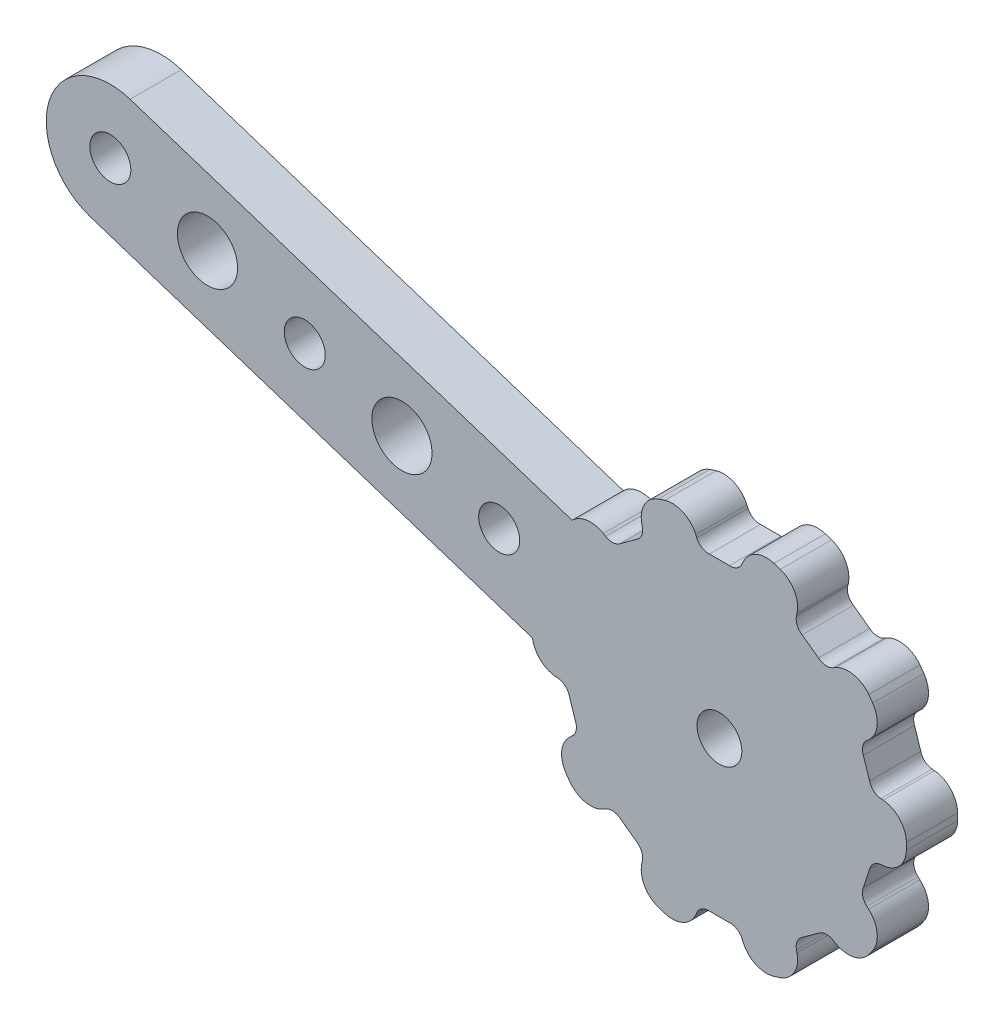
from build123d import *

# Parameters (mm, degrees)
SKETCH1_R           = 1.75
BOSS_EXTRUDE1_DEPTH = 4
BOSS_EXTRUDE2_START = -4
SKETCH2_R           = 1.6
SKETCH2_R_2         = 2.35
BOSS_EXTRUDE2_DEPTH = 4
FILLET1_R           = 2


with BuildPart() as part:
    # Sketch1 → Boss-Extrude1 (new body)
    with BuildSketch(Plane.XY):
        with BuildLine():
            Line((6.458174517, 10.22648556), (7.730280052, 9.302246788))
            ThreePointArc((7.730280052, 9.302246788), (8.293531937, 9.074228241), (8.884801529, 9.214390334))
            ThreePointArc((8.884801529, 9.214390334), (9.700788202, 9.679292345), (10.537793023, 10.105192636))
            ThreePointArc((10.537793023, 10.105192636), (11.811648118, 8.581664683), (12.866966432, 6.899360466))
            ThreePointArc((12.866966432, 6.899360466), (12.203262471, 6.234932004), (11.508960635, 5.602545185))
            ThreePointArc((11.508960635, 5.602545185), (11.192946211, 5.083526854), (11.235750332, 4.477380873))
            Line((11.235750332, 4.477380873), (11.721651409, 2.981931127))
            ThreePointArc((11.721651409, 2.981931127), (12.043305816, 2.466389096), (12.604038176, 2.232243064))
            ThreePointArc((12.604038176, 2.232243064), (13.537447807, 2.12873176), (14.464936842, 1.981313243))
            ThreePointArc((14.464936842, 1.981313243), (14.6, 0), (14.464936842, -1.981313243))
            ThreePointArc((14.464936842, -1.981313243), (13.537447807, -2.12873176), (12.604038176, -2.232243064))
            ThreePointArc((12.604038176, -2.232243064), (12.043305816, -2.466389096), (11.721651409, -2.981931127))
            Line((11.721651409, -2.981931127), (11.235750332, -4.477380873))
            ThreePointArc((11.235750332, -4.477380873), (11.192946211, -5.083526854), (11.508960635, -5.602545185))
            ThreePointArc((11.508960635, -5.602545185), (12.203262471, -6.234932004), (12.866966432, -6.899360466))
            ThreePointArc((12.866966432, -6.899360466), (11.811648118, -8.581664683), (10.537793023, -10.105192636))
            ThreePointArc((10.537793023, -10.105192636), (9.700788202, -9.679292345), (8.884801529, -9.214390334))
            ThreePointArc((8.884801529, -9.214390334), (8.293531937, -9.074228241), (7.730280052, -9.302246788))
            Line((7.730280052, -9.302246788), (6.458174517, -10.22648556))
            ThreePointArc((6.458174517, -10.22648556), (6.067261587, -10.691708329), (6.017851306, -11.297351596))
            ThreePointArc((6.017851306, -11.297351596), (6.207845644, -12.21706366), (6.354252177, -13.144712978))
            ThreePointArc((6.354252177, -13.144712978), (4.511648118, -13.885425138), (2.585570436, -14.369231904))
            ThreePointArc((2.585570436, -14.369231904), (2.158757221, -13.532692241), (1.771872682, -12.676953681))
            ThreePointArc((1.771872682, -12.676953681), (1.375910744, -12.216020619), (0.786204458, -12.069420349))
            Line((0.786204458, -12.069420349), (-0.786204458, -12.069420349))
            ThreePointArc((-0.786204458, -12.069420349), (-1.375910744, -12.216020619), (-1.771872682, -12.676953681))
            ThreePointArc((-1.771872682, -12.676953681), (-2.158757221, -13.532692241), (-2.585570436, -14.369231904))
            ThreePointArc((-2.585570436, -14.369231904), (-4.511648118, -13.885425138), (-6.354252177, -13.144712978))
            ThreePointArc((-6.354252177, -13.144712978), (-6.207845644, -12.21706366), (-6.017851306, -11.297351596))
            ThreePointArc((-6.017851306, -11.297351596), (-6.067261587, -10.691708329), (-6.458174517, -10.22648556))
            Line((-6.458174517, -10.22648556), (-7.730280052, -9.302246788))
            ThreePointArc((-7.730280052, -9.302246788), (-8.293531937, -9.074228241), (-8.884801529, -9.214390334))
            ThreePointArc((-8.884801529, -9.214390334), (-9.700788202, -9.679292345), (-10.537793023, -10.105192636))
            ThreePointArc((-10.537793023, -10.105192636), (-11.811648118, -8.581664683), (-12.866966432, -6.899360466))
            ThreePointArc((-12.866966432, -6.899360466), (-12.203262471, -6.234932004), (-11.508960635, -5.602545185))
            ThreePointArc((-11.508960635, -5.602545185), (-11.192946211, -5.083526854), (-11.235750332, -4.477380873))
            Line((-11.235750332, -4.477380873), (-11.721651409, -2.981931127))
            ThreePointArc((-11.721651409, -2.981931127), (-12.043305816, -2.466389096), (-12.604038176, -2.232243064))
            ThreePointArc((-12.604038176, -2.232243064), (-13.537447807, -2.12873176), (-14.464936842, -1.981313243))
            ThreePointArc((-14.464936842, -1.981313243), (-14.6, 0), (-14.464936842, 1.981313243))
            ThreePointArc((-14.464936842, 1.981313243), (-13.537447807, 2.12873176), (-12.604038176, 2.232243064))
            ThreePointArc((-12.604038176, 2.232243064), (-12.043305816, 2.466389096), (-11.721651409, 2.981931127))
            Line((-11.721651409, 2.981931127), (-11.235750332, 4.477380873))
            ThreePointArc((-11.235750332, 4.477380873), (-11.192946211, 5.083526854), (-11.508960635, 5.602545185))
            ThreePointArc((-11.508960635, 5.602545185), (-12.203262471, 6.234932004), (-12.866966432, 6.899360466))
            ThreePointArc((-12.866966432, 6.899360466), (-11.811648118, 8.581664683), (-10.537793023, 10.105192636))
            ThreePointArc((-10.537793023, 10.105192636), (-9.700788202, 9.679292345), (-8.884801529, 9.214390334))
            ThreePointArc((-8.884801529, 9.214390334), (-8.293531937, 9.074228241), (-7.730280052, 9.302246788))
            Line((-7.730280052, 9.302246788), (-6.458174517, 10.22648556))
            ThreePointArc((-6.458174517, 10.22648556), (-6.067261587, 10.691708329), (-6.017851306, 11.297351596))
            ThreePointArc((-6.017851306, 11.297351596), (-6.207845644, 12.21706366), (-6.354252177, 13.144712978))
            ThreePointArc((-6.354252177, 13.144712978), (-4.511648118, 13.885425138), (-2.585570436, 14.369231904))
            ThreePointArc((-2.585570436, 14.369231904), (-2.158757221, 13.532692241), (-1.771872682, 12.676953681))
            ThreePointArc((-1.771872682, 12.676953681), (-1.375910744, 12.216020619), (-0.786204458, 12.069420349))
            Line((-0.786204458, 12.069420349), (0.786204458, 12.069420349))
            ThreePointArc((0.786204458, 12.069420349), (1.375910744, 12.216020619), (1.771872682, 12.676953681))
            ThreePointArc((1.771872682, 12.676953681), (2.158757221, 13.532692241), (2.585570436, 14.369231904))
            ThreePointArc((2.585570436, 14.369231904), (4.511648118, 13.885425138), (6.354252177, 13.144712978))
            ThreePointArc((6.354252177, 13.144712978), (6.207845644, 12.21706366), (6.017851306, 11.297351596))
            ThreePointArc((6.017851306, 11.297351596), (6.067261587, 10.691708329), (6.458174517, 10.22648556))
        make_face()
        Circle(SKETCH1_R, mode=Mode.SUBTRACT)
    extrude(amount=BOSS_EXTRUDE1_DEPTH)

    # Sketch2 → Boss-Extrude2 (add)
    with BuildSketch(Plane(origin=(0, 0, 0), x_dir=(-1, 0, 0), z_dir=(0, 0, -1)).offset(BOSS_EXTRUDE2_START)):
        with BuildLine():
            Line((7.965480191, 7.845452525), (46.007740843, 20.2061323))
            ThreePointArc((46.007740843, 20.2061323), (52.308108396, 16.995934691), (49.097910787, 10.695567137))
            Line((49.097910787, 10.695567137), (11.055650135, -1.665112638))
            Line((11.055650135, -1.665112638), (7.965480191, 7.845452525))
        make_face()
        with Locations((47.552825815, 15.450849719)):
            Circle(SKETCH2_R, mode=Mode.SUBTRACT)
        with Locations((39.963394815, 12.984894104)):
            Circle(SKETCH2_R_2, mode=Mode.SUBTRACT)
        with Locations((32.373963815, 10.518938489)):
            Circle(SKETCH2_R, mode=Mode.SUBTRACT)
        with Locations((24.784532815, 8.052982873)):
            Circle(SKETCH2_R_2, mode=Mode.SUBTRACT)
        with Locations((17.195101815, 5.587027258)):
            Circle(SKETCH2_R, mode=Mode.SUBTRACT)
    extrude(amount=BOSS_EXTRUDE2_DEPTH)

    # Fillet1
    # the kernel refuses this fillet: 2 mm, written as the material it takes off along each edge
    with BuildSketch(Plane(origin=(-14.464936842, -1.981313243, -4.187001337), x_dir=(-0.08564855994772169, 0.9963254107864967, 0), z_dir=(0, 0, 1))) as fillet1_piece_1:
        with BuildLine():
            CenterArc((1.593192122, -1.99621856), FILLET1_R, 93.523868458, 76.001739978)
            Line((-0.373480398, -1.63262648), (-0.412813848, -1.625354638))
            ThreePointArc((-0.412813848, -1.625354638), (-0.242909966, -0.803463818), (-0.038582997, 0.010552361))
            Line((-0.038582997, 0.010552361), (-0.00201406, 0.039949262))
            ThreePointArc((-0.00201406, 0.039949262), (0.73513172, 0.058519233), (1.467804867, 0.039924371))
            Line((1.467804867, 0.039924371), (1.470263441, 0))
        make_face()
    extrude(amount=12.374002673, mode=Mode.SUBTRACT)
    with BuildSketch(Plane(origin=(-10.537793023, 10.105192636, -4.187001337), x_dir=(0.8827178463652419, -0.4699033982727826, 0), z_dir=(0, 0, 1))) as fillet1_piece_2:
        with BuildLine():
            CenterArc((1.590668977, -1.998229687), FILLET1_R, 87.589097028, 76.001739978)
            Line((-0.327868641, -1.433239945), (-0.366239393, -1.42194015))
            ThreePointArc((-0.366239393, -1.42194015), (-0.220979949, -0.703570188), (-0.038494143, 0.010872025))
            Line((-0.038494143, 0.010872025), (-0.001682631, 0.039964594))
            ThreePointArc((-0.001682631, 0.039964594), (0.837400267, 0.057620746), (1.676483166, 0.039964594))
            Line((1.676483166, 0.039964594), (1.674800535, 0))
        make_face()
    extrude(amount=12.374002673, mode=Mode.SUBTRACT)
    with BuildSketch(Plane(origin=(-6.354252177, 13.144712978, -4.315988382), x_dir=(0.9244796007365503, 0.3812315147282405, 0), z_dir=(0, 0, 1)), Plane(origin=(2.585570436, 14.369231904, -4.315988382), x_dir=(0.9720019700152155, -0.23497270115172955, 0), z_dir=(0, 0, 1)), Plane(origin=(10.537793023, 10.105192636, -4.315988382), x_dir=(0.6482526238799229, -0.7614253316201104, 0), z_dir=(0, 0, 1)), Plane(origin=(14.464936842, 1.981313243, -4.315988382), x_dir=(0.07689280871880408, -0.9970393653047674, 0), z_dir=(0, 0, 1)), Plane(origin=(12.866966432, -6.899360466, -4.315988382), x_dir=(-0.5238374458824551, -0.8518182495646274, 0), z_dir=(0, 0, 1)), Plane(origin=(6.354252177, -13.144712978, -4.315988382), x_dir=(-0.9244796007365504, -0.3812315147282399, 0), z_dir=(0, 0, 1)), Plane(origin=(-2.585570436, -14.369231904, -4.315988382), x_dir=(-0.9720019700152157, 0.23497270115172855, 0), z_dir=(0, 0, 1)), Plane(origin=(-10.537793023, -10.105192636, -4.315988382), x_dir=(-0.6482526238799226, 0.7614253316201107, 0), z_dir=(0, 0, 1))) as fillet1_piece_3:
        with BuildLine():
            CenterArc((1.608149096, -1.996501396), FILLET1_R, 86.610517624, 83.465059025)
            Line((-0.361922802, -1.651803385), (-0.40132424, -1.644909425))
            ThreePointArc((-0.40132424, -1.644909425), (-0.237581401, -0.813495816), (-0.038674208, 0.010213013))
            Line((-0.038674208, 0.010213013), (-0.002364925, 0.039930028))
            ThreePointArc((-0.002364925, 0.039930028), (0.863197676, 0.065539812), (1.728760278, 0.039930028))
            Line((1.728760278, 0.039930028), (1.726395353, 0))
        make_face()
    extrude(amount=12.631976765, mode=Mode.SUBTRACT)
    with BuildSketch(Plane(origin=(-2.585570436, 14.369231904, -4.315988382), x_dir=(0.43756555631998817, -0.8991865123111997, 0), z_dir=(0, 0, 1)), Plane(origin=(6.354252177, 13.144712978, -4.315988382), x_dir=(-0.1745305997808264, -0.9846517504885395, 0), z_dir=(0, 0, 1)), Plane(origin=(12.866966432, 6.899360466, -4.315988382), x_dir=(-0.719961998842273, -0.6940134870613388, 0), z_dir=(0, 0, 1)), Plane(origin=(14.464936842, -1.981313243, -4.315988382), x_dir=(-0.9903923849542835, -0.13828566022753844, 0), z_dir=(0, 0, 1)), Plane(origin=(10.537793023, -10.105192636, -4.315988382), x_dir=(-0.8825265422128264, 0.47026258865645726, 0), z_dir=(0, 0, 1)), Plane(origin=(2.585570436, -14.369231904, -4.315988382), x_dir=(-0.4375655563199897, 0.899186512311199, 0), z_dir=(0, 0, 1)), Plane(origin=(-6.354252177, -13.144712978, -4.315988382), x_dir=(0.17453059978082774, 0.9846517504885393, 0), z_dir=(0, 0, 1)), Plane(origin=(-12.866966432, -6.899360466, -4.315988382), x_dir=(0.7199619988422736, 0.694013487061338, 0), z_dir=(0, 0, 1))) as fillet1_piece_4:
        with BuildLine():
            CenterArc((1.606043881, -1.998195283), FILLET1_R, 87.565780038, 83.465059025)
            Line((-0.369500914, -1.686389632), (-0.40901181, -1.680153518))
            ThreePointArc((-0.40901181, -1.680153518), (-0.248771516, -0.82916731), (-0.038498565, 0.010856359))
            Line((-0.038498565, 0.010856359), (-0.001698895, 0.039963906))
            ThreePointArc((-0.001698895, 0.039963906), (0.845494314, 0.05796318), (1.692687522, 0.039963906))
            Line((1.692687522, 0.039963906), (1.690988628, 0))
        make_face()
    extrude(amount=12.631976765, mode=Mode.SUBTRACT)


solid = part.part
